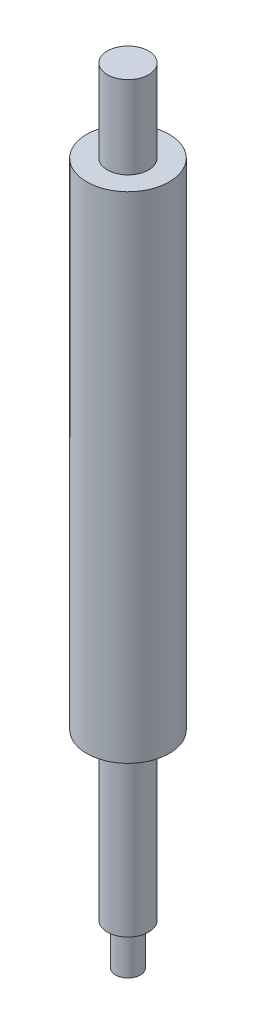
from build123d import *


with BuildPart() as part:
    # Esquisse1 → Révolution1 (revolve)
    with BuildSketch(Plane.XY):
        Polygon((2.5, 5), (1.5, 5), (1.5, 0), (0, 0), (0, 95), (2.5, 95), (2.5, 85), (5, 85), (5, 25), (2.5, 25), align=None)
    revolve(axis=Axis((0, 95, 0), (0, -1, 0)))


solid = part.part
